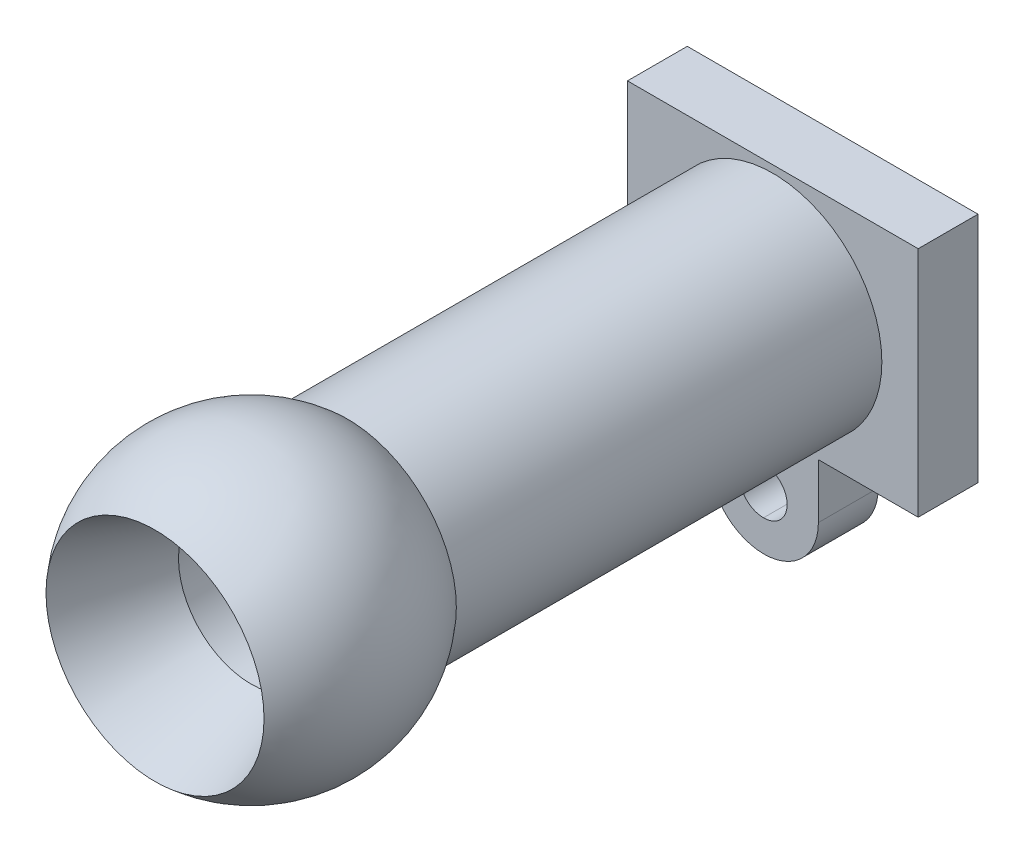
from build123d import *

# Parameters (mm, degrees)
SKETCH7_R               = 7.5
BOSS_EXTRUDE1_DEPTH     = 40
BOSS_EXTRUDE2_START     = -4.113978
SKETCH9_W               = 20
SKETCH9_H               = 16
BOSS_EXTRUDE2_DEPTH     = 4.113978
SKETCH10_W              = 7.5
SKETCH10_H              = 7.5
BOSS_EXTRUDE3_DEPTH     = 4.113977514
SKETCH11_R              = 1.6
CUT_EXTRUDE2_DEPTH      = 4.113977514
CUT_EXTRUDE1_DEPTH      = 45.048268978
CUT_EXTRUDE1_DEPTH_BACK = 45.048268978
SKETCH2_R               = 5
SKETCH14_R              = 1.6
CUT_EXTRUDE4_DEPTH      = 54.293995909
FILLET4_R               = 3.75


with BuildPart() as part:
    # Sketch1 → Revolve2 (revolve)
    with BuildSketch(Plane.XY):
        with BuildLine():
            Line((0, 10), (0, -10))
            ThreePointArc((0, -10), (10, 0), (0, 10))
        make_face()
    revolve(axis=Axis((0, 10, 0), (0, -1, 0)))

    # Sketch7 → Boss-Extrude1 (add)
    with BuildSketch(Plane.XY):
        Circle(SKETCH7_R)
    extrude(amount=-BOSS_EXTRUDE1_DEPTH)

    # Sketch9 → Boss-Extrude2 (add)
    with BuildSketch(Plane(origin=(0, 0, -40), x_dir=(-1, 0, 0), z_dir=(0, 0, -1)).offset(BOSS_EXTRUDE2_START)):
        Rectangle(SKETCH9_W, SKETCH9_H)
    extrude(amount=BOSS_EXTRUDE2_DEPTH)

    # Sketch10 → Boss-Extrude3 (add)
    with BuildSketch(Plane(origin=(0, 0, -40), x_dir=(-1, 0, 0), z_dir=(0, 0, -1))):
        with Locations((0.616125117, -11.75)):
            Rectangle(SKETCH10_W, SKETCH10_H)
    extrude(amount=-BOSS_EXTRUDE3_DEPTH)

    # Sketch11 → Cut-Extrude2 (cut)
    with BuildSketch(Plane.XY.offset(-40)):
        with Locations(Location((-0.662105116, -11.75, 0), (0, 0, 270))):
            Circle(SKETCH11_R)
    extrude(amount=CUT_EXTRUDE2_DEPTH, mode=Mode.SUBTRACT)

    # Sketch2 → Cut-Extrude1 (cut, two sides: drawn at the far end of the back side and taken through both)
    with BuildSketch(Plane.XY.offset(-CUT_EXTRUDE1_DEPTH_BACK)):
        Circle(SKETCH2_R)
    extrude(amount=CUT_EXTRUDE1_DEPTH + CUT_EXTRUDE1_DEPTH_BACK, mode=Mode.SUBTRACT)

    # Sketch4 → Cut-Revolve1 (revolve, cut)
    with BuildSketch(Plane(origin=(0, 0, 0), x_dir=(1, 0, 0), z_dir=(0, 1, 0))):
        Polygon((0, 0), (-5, 0), (-8.778685118, -10), (0, -10), align=None)
    revolve(axis=Axis((0, 0, -40), (0, 0, 1)), mode=Mode.SUBTRACT)

    # Sketch14 → Cut-Extrude4 (cut, through all)
    with BuildSketch(Plane(origin=(0, 0, -40), x_dir=(-1, 0, 0), z_dir=(0, 0, -1))):
        with Locations((0.616125117, -11.75)):
            Circle(SKETCH14_R)
    extrude(amount=-CUT_EXTRUDE4_DEPTH, mode=Mode.SUBTRACT)

    # Fillet4
    fillet4_edges = [part.edges().sort_by_distance(p)[0] for p in [
        (3.133874883, -15.5, -37.943011243),
        (-4.366125117, -15.5, -37.943011243),
    ]]
    fillet(fillet4_edges, radius=FILLET4_R - 0.0001)  # a hair under: the kernel refuses the full size


solid = part.part
